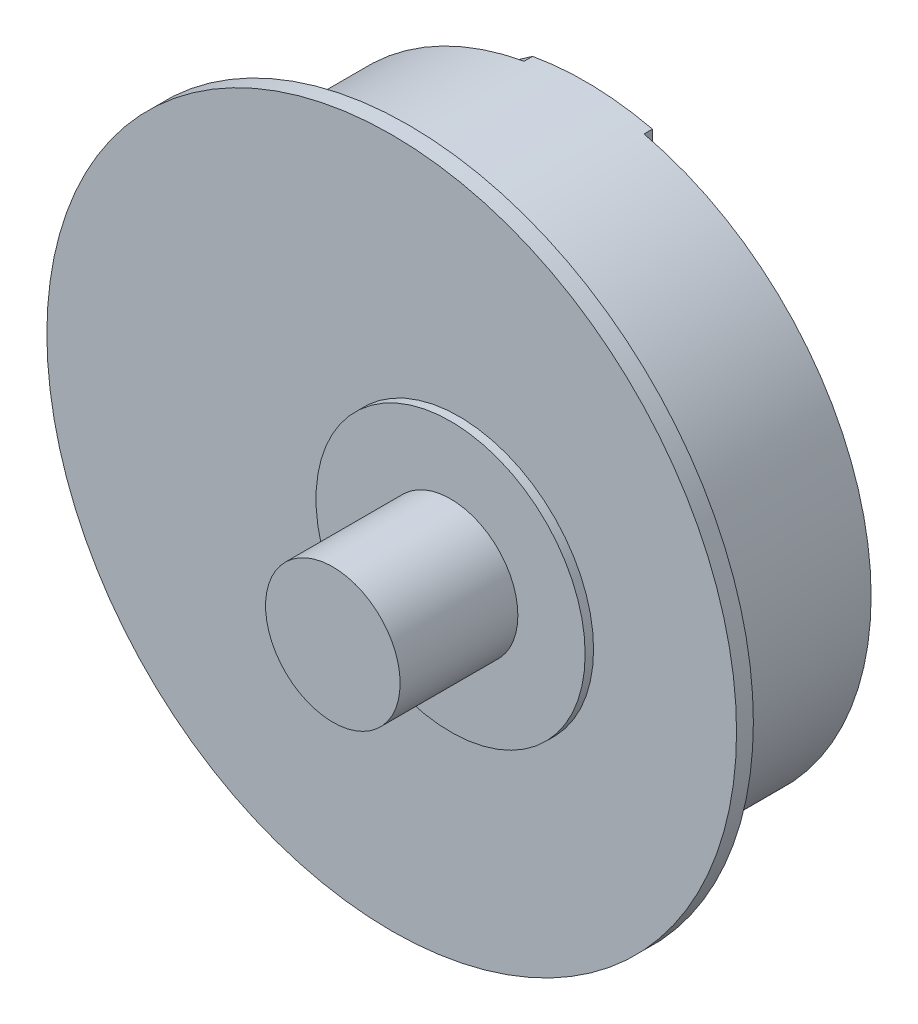
from build123d import *
from build123d.topology import SkipClean

# Parameters (mm, degrees)
SKETCH1_R           = 17.5
BOSS_EXTRUDE1_DEPTH = 5
SKETCH6_R           = 17.5
BOSS_EXTRUDE7_DEPTH = 5
SKETCH3_R           = 20.5
BOSS_EXTRUDE3_DEPTH = 1
SKETCH4_R           = 8
BOSS_EXTRUDE5_DEPTH = 0.5
SKETCH5_R           = 4
BOSS_EXTRUDE6_DEPTH = 7
BOSS_EXTRUDE8_START = 0.5
BOSS_EXTRUDE8_DEPTH = 0.5


with BuildPart() as part:
    # Sketch1 → Boss-Extrude1 (new body)
    with BuildSketch(Plane.XY):
        with Locations((-4, 0)):
            Circle(SKETCH1_R)
        with BuildLine():
            Line((-5, -6.244997998), (-5, 6.244997998))
            ThreePointArc((-5, 6.244997998), (8, 0), (-5, -6.244997998))
        make_face(mode=Mode.SUBTRACT)
    extrude(amount=BOSS_EXTRUDE1_DEPTH)

    # Sketch6 → Boss-Extrude7 (add)
    with BuildSketch(Plane.XY.offset(5)):
        with Locations((-4, 0)):
            Circle(SKETCH6_R)
    extrude(amount=BOSS_EXTRUDE7_DEPTH)

    # Sketch3 → Boss-Extrude3 (add)
    with BuildSketch(Plane(origin=(0, 0, 10), x_dir=(-1, 0, 0), z_dir=(0, 0, -1))):
        with Locations((4, 0)):
            Circle(SKETCH3_R)
    extrude(amount=-BOSS_EXTRUDE3_DEPTH)

    # Sketch4 → Boss-Extrude5 (add)
    with BuildSketch(Plane.XY.offset(11)):
        Circle(SKETCH4_R)
    extrude(amount=BOSS_EXTRUDE5_DEPTH)

    # Sketch5 → Boss-Extrude6 (add)
    with BuildSketch(Plane.XY.offset(11.5)):
        Circle(SKETCH5_R)
    extrude(amount=BOSS_EXTRUDE6_DEPTH)

    # Sketch7 → Boss-Extrude8 (add)
    with SkipClean():  # the faces are left unmerged after this step: merging them gives an invalid solid
        with BuildSketch(Plane(origin=(0, 0, 0), x_dir=(-1, 0, 0), z_dir=(0, 0, -1)).offset(BOSS_EXTRUDE8_START)):
            with BuildLine():
                Line((0, -8), (0, -17.036725037))
                ThreePointArc((0, -17.036725037), (3.553136552, -17.494293728), (7.125, -17.218721642))
                ThreePointArc((7.125, -17.218721642), (14.004339755, -9.802741963), (16.5, 0))
                ThreePointArc((16.5, 0), (14.004339755, 9.802741963), (7.125, 17.218721642))
                ThreePointArc((7.125, 17.218721642), (3.553136552, 17.494293728), (0, 17.036725037))
                Line((0, 17.036725037), (0, 8))
                ThreePointArc((0, 8), (2.649529771, 7.548509256), (5, 6.244997998))
                Line((5, 6.244997998), (5, -6.244997998))
                ThreePointArc((5, -6.244997998), (2.649529771, -7.548509256), (0, -8))
            make_face()
        extrude(amount=-BOSS_EXTRUDE8_DEPTH)


solid = part.part
